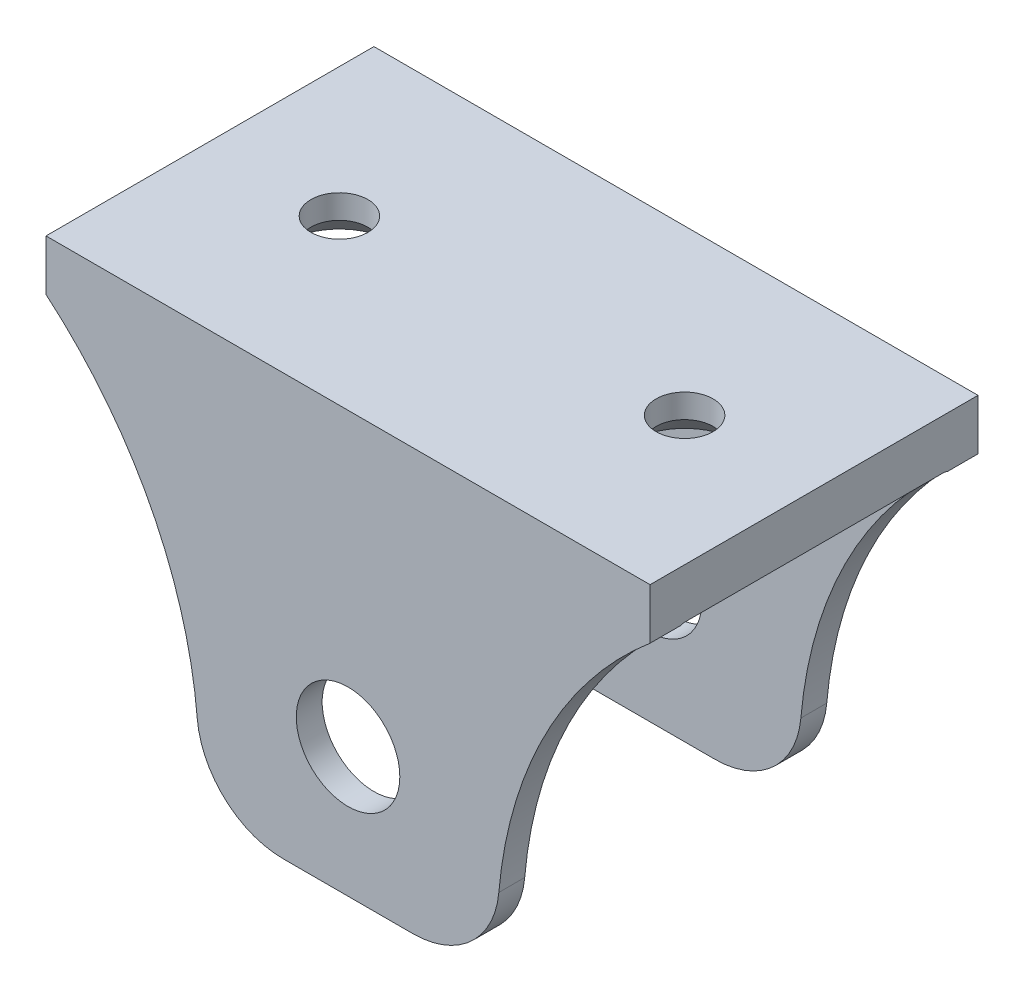
from build123d import *

# Parameters (mm, degrees)
SZKIC1_R                                 = 6
DODANIE_WYCI_GNI_CIE1_DEPTH              = 38
SZKIC2_W                                 = 70
SZKIC2_H                                 = 32
WYTNIJ_WYCI_GNI_CIE1_DEPTH               = 43
ZAOKR_GLENIE1_R                          = 1
POG_BIENIE_STO_KOWE_POD_M6_RUB_Z_2_COUNT = 2
POG_BIENIE_STO_KOWE_POD_M6_RUB_Z_2_PITCH = 40


with BuildPart() as part:
    # Szkic1 → Dodanie-wyciągnięcie1 (new body)
    with BuildSketch(Plane.XY):
        with BuildLine():
            Line((70, 48.768640881), (0, 48.768640881))
            Line((0, 48.768640881), (0, 42.89244343))
            ThreePointArc((0, 42.89244343), (12.102069866, 27.737632724), (17.527104902, 9.1178213))
            ThreePointArc((17.527104902, 9.1178213), (20.736146372, 2.623625993), (27.488116936, 0))
            Line((27.488116936, 0), (42.511883064, 0))
            ThreePointArc((42.511883064, 0), (49.263853628, 2.623625993), (52.472895098, 9.1178213))
            ThreePointArc((52.472895098, 9.1178213), (57.897930134, 27.737632724), (70, 42.89244343))
            Line((70, 42.89244343), (70, 48.768640881))
        make_face()
        with Locations((35, 15)):
            Circle(SZKIC1_R, mode=Mode.SUBTRACT)
    extrude(amount=DODANIE_WYCI_GNI_CIE1_DEPTH)

    # Szkic2 → Wytnij-wyciągnięcie1 (cut)
    with BuildSketch(Plane.XZ):
        with Locations((35, 19)):
            Rectangle(SZKIC2_W, SZKIC2_H)
    extrude(amount=-WYTNIJ_WYCI_GNI_CIE1_DEPTH, mode=Mode.SUBTRACT)

    # Zaokrąglenie1
    zaokr_glenie1_edges = [part.edges().sort_by_distance(p)[0] for p in [
        (35, 43, 35),
        (35, 43, 3),
    ]]
    fillet(zaokr_glenie1_edges, radius=ZAOKR_GLENIE1_R)

    # Szkic5 → Pogłębienie stożkowe pod M6 Śrubę z łbem soczewkowym1 (revolve, cut)
    with BuildSketch(Plane(origin=(15, 43, 19), x_dir=(0, 0, -1), z_dir=(1, 0, 0))):
        Polygon((0, 0), (0, 5.768640881), (3.3, 5.768640881), (3.3, 3), (6.3, 0), align=None)
    pog_bienie_sto_kowe_pod_m6_rub_z_bem = revolve(axis=Axis((15, 36.65, 19), (0, 1, 0)), mode=Mode.SUBTRACT)

    # Pog_bienie sto_kowe pod M6 _rub_ z _ 2: Pogłębienie stożkowe pod M6 Śrubę z łbem soczewkowym1 ×2
    with Locations(*[(i * POG_BIENIE_STO_KOWE_POD_M6_RUB_Z_2_PITCH, 0, 0) for i in range(1, POG_BIENIE_STO_KOWE_POD_M6_RUB_Z_2_COUNT)]):
        add(pog_bienie_sto_kowe_pod_m6_rub_z_bem, mode=Mode.SUBTRACT)


solid = part.part
